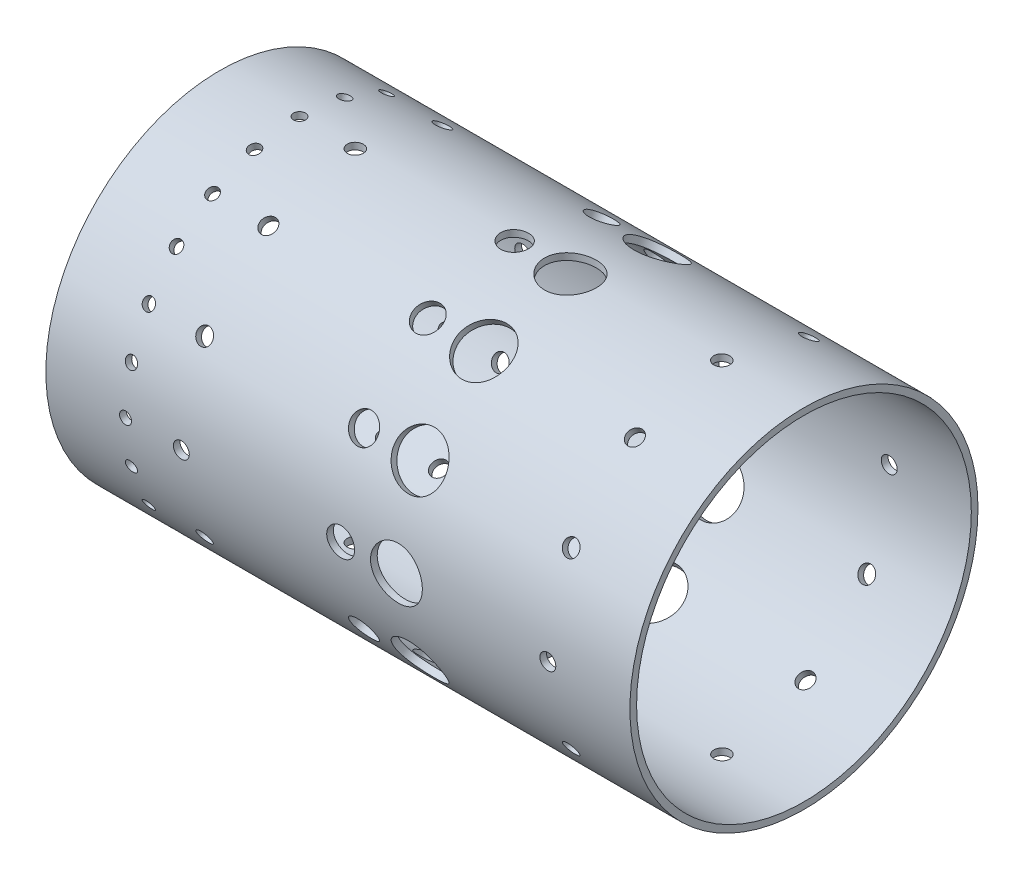
from build123d import *

# Parameters (mm, degrees)
SKETCH1_R           = 21.844
SKETCH1_R_2         = 21.0058
BOSS_EXTRUDE1_DEPTH = 73.3044
SKETCH4_R           = 0.75
CUT_EXTRUDE1_DEPTH  = 80.547820406
CIRPATTERN1_COUNT   = 24
SKETCH5_R           = 1
CUT_EXTRUDE3_DEPTH  = 80.547820553
CIRPATTERN2_COUNT   = 12
SKETCH6_R           = 1.75
CUT_EXTRUDE4_DEPTH  = 80.547820555
CIRPATTERN3_COUNT   = 12
SKETCH7_R           = 3.25
CUT_EXTRUDE5_DEPTH  = 80.547820561
CIRPATTERN5_COUNT   = 12
SKETCH8_R           = 1
CUT_EXTRUDE6_DEPTH  = 80.547820561
CIRPATTERN6_COUNT   = 12


with BuildPart() as part:
    # Sketch1 → Boss-Extrude1 (new body)
    with BuildSketch(Plane(origin=(0, 0, 0), x_dir=(0, 0, -1), z_dir=(1, 0, 0))):
        Circle(SKETCH1_R)
        Circle(SKETCH1_R_2, mode=Mode.SUBTRACT)
    extrude(amount=BOSS_EXTRUDE1_DEPTH)

    # Sketch4 → Cut-Extrude1 (cut, through all)
    with BuildSketch(Plane(origin=(0, 0, 0), x_dir=(1, 0, 0), z_dir=(0, 1, 0))):
        with Locations(Location((10, 0, 0), (0, 0, 270))):
            Circle(SKETCH4_R)
    cut_extrude1 = extrude(amount=-CUT_EXTRUDE1_DEPTH, mode=Mode.SUBTRACT)

    # CirPattern1: Cut-Extrude1 ×24 about axis
    cirpattern1_axis = Axis((0, 0, 0), (1, 0, 0))
    for i in range(1, CIRPATTERN1_COUNT):
        add(cut_extrude1.rotate(cirpattern1_axis, i * 360 / CIRPATTERN1_COUNT), mode=Mode.SUBTRACT)

    # Sketch5 → Cut-Extrude3 (cut, through all)
    with BuildSketch(Plane(origin=(0, 0, 0), x_dir=(1, 0, 0), z_dir=(0, 1, 0))):
        with Locations(Location((17, 0, 0), (0, 0, 270))):
            Circle(SKETCH5_R)
    cut_extrude3 = extrude(amount=-CUT_EXTRUDE3_DEPTH, mode=Mode.SUBTRACT)

    # CirPattern2: Cut-Extrude3 ×12 about axis
    cirpattern2_axis = Axis((0, 0, 0), (1, 0, 0))
    for i in range(1, CIRPATTERN2_COUNT):
        add(cut_extrude3.rotate(cirpattern2_axis, i * 360 / CIRPATTERN2_COUNT), mode=Mode.SUBTRACT)

    # Sketch6 → Cut-Extrude4 (cut, through all)
    with BuildSketch(Plane(origin=(0, 0, 0), x_dir=(1, 0, 0), z_dir=(0, 1, 0))):
        with Locations(Location((37, 0, 0), (0, 0, 270))):
            Circle(SKETCH6_R)
    cut_extrude4 = extrude(amount=-CUT_EXTRUDE4_DEPTH, mode=Mode.SUBTRACT)

    # CirPattern3: Cut-Extrude4 ×12 about axis
    cirpattern3_axis = Axis((0, 0, 0), (1, 0, 0))
    for i in range(1, CIRPATTERN3_COUNT):
        add(cut_extrude4.rotate(cirpattern3_axis, i * 360 / CIRPATTERN3_COUNT), mode=Mode.SUBTRACT)

    # Sketch7 → Cut-Extrude5 (cut, through all)
    with BuildSketch(Plane(origin=(0, 0, 0), x_dir=(1, 0, 0), z_dir=(0, 1, 0))):
        with Locations(Location((44, 0, 0), (0, 0, 270))):
            Circle(SKETCH7_R)
    cut_extrude5 = extrude(amount=-CUT_EXTRUDE5_DEPTH, mode=Mode.SUBTRACT)

    # CirPattern5: Cut-Extrude5 ×12 about axis
    cirpattern5_axis = Axis((0, 0, 0), (1, 0, 0))
    for i in range(1, CIRPATTERN5_COUNT):
        add(cut_extrude5.rotate(cirpattern5_axis, i * 360 / CIRPATTERN5_COUNT), mode=Mode.SUBTRACT)

    # Sketch8 → Cut-Extrude6 (cut, through all)
    with BuildSketch(Plane.XY):
        with Locations((63, 0)):
            Circle(SKETCH8_R)
    cut_extrude6 = extrude(amount=-CUT_EXTRUDE6_DEPTH, mode=Mode.SUBTRACT)

    # CirPattern6: Cut-Extrude6 ×12 about axis
    cirpattern6_axis = Axis((0, 0, 0), (1, 0, 0))
    for i in range(1, CIRPATTERN6_COUNT):
        add(cut_extrude6.rotate(cirpattern6_axis, i * 360 / CIRPATTERN6_COUNT), mode=Mode.SUBTRACT)


solid = part.part
